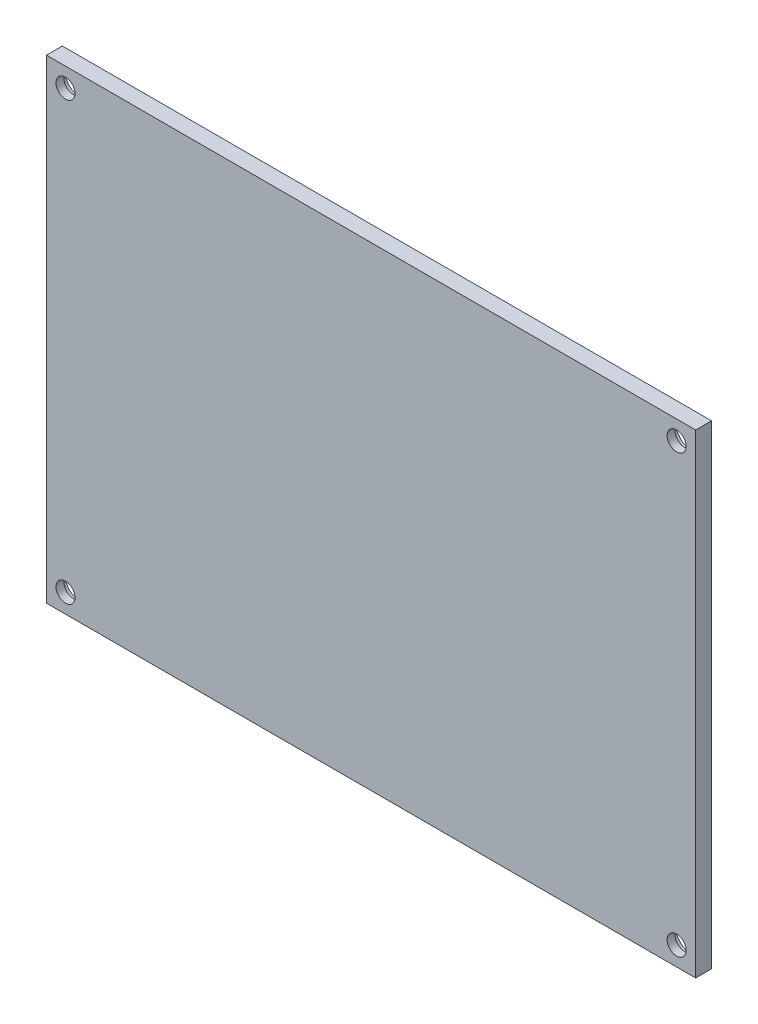
from build123d import *

# Parameters (mm, degrees)
SKETCH1_W                                        = 81.8
SKETCH1_H                                        = 59.8
BOSS_EXTRUDE1_DEPTH                              = 2
CBORE_FOR_M2_PAN_HEAD_MACHINE_SCREW1_D           = 2.4
CBORE_FOR_M2_PAN_HEAD_MACHINE_SCREW1_DEPTH       = 6
CBORE_FOR_M2_PAN_HEAD_MACHINE_SCREW1_CBORE_D     = 4.25
CBORE_FOR_M2_PAN_HEAD_MACHINE_SCREW1_CBORE_DEPTH = 1
CBORE_FOR_M2_PAN_HEAD_MACHINE_SCREW1_TIP         = 0.721032743


with BuildPart() as part:
    # Sketch1 → Boss-Extrude1 (new body)
    with BuildSketch(Plane.XY):
        with Locations((95.591153219, 3.136127214)):
            Rectangle(SKETCH1_W, SKETCH1_H)
    extrude(amount=BOSS_EXTRUDE1_DEPTH)

    # CBORE for M2 Pan Head Machine Screw1
    with Locations(Plane(origin=(0, 0, 0), x_dir=(-1, 0, 0), z_dir=(0, 0, -1))):
        with Locations((-134.091153219, 30.636127214), (-57.091153219, 30.636127214), (-57.091153219, -24.363872786), (-134.091153219, -24.363872786)):
            CounterBoreHole(CBORE_FOR_M2_PAN_HEAD_MACHINE_SCREW1_D / 2, CBORE_FOR_M2_PAN_HEAD_MACHINE_SCREW1_CBORE_D / 2, CBORE_FOR_M2_PAN_HEAD_MACHINE_SCREW1_CBORE_DEPTH, depth=CBORE_FOR_M2_PAN_HEAD_MACHINE_SCREW1_DEPTH)
            with Locations((0, 0, -(CBORE_FOR_M2_PAN_HEAD_MACHINE_SCREW1_DEPTH + CBORE_FOR_M2_PAN_HEAD_MACHINE_SCREW1_TIP / 2))):  # 118° drill point
                Cone(0, CBORE_FOR_M2_PAN_HEAD_MACHINE_SCREW1_D / 2, CBORE_FOR_M2_PAN_HEAD_MACHINE_SCREW1_TIP, mode=Mode.SUBTRACT)


solid = part.part
